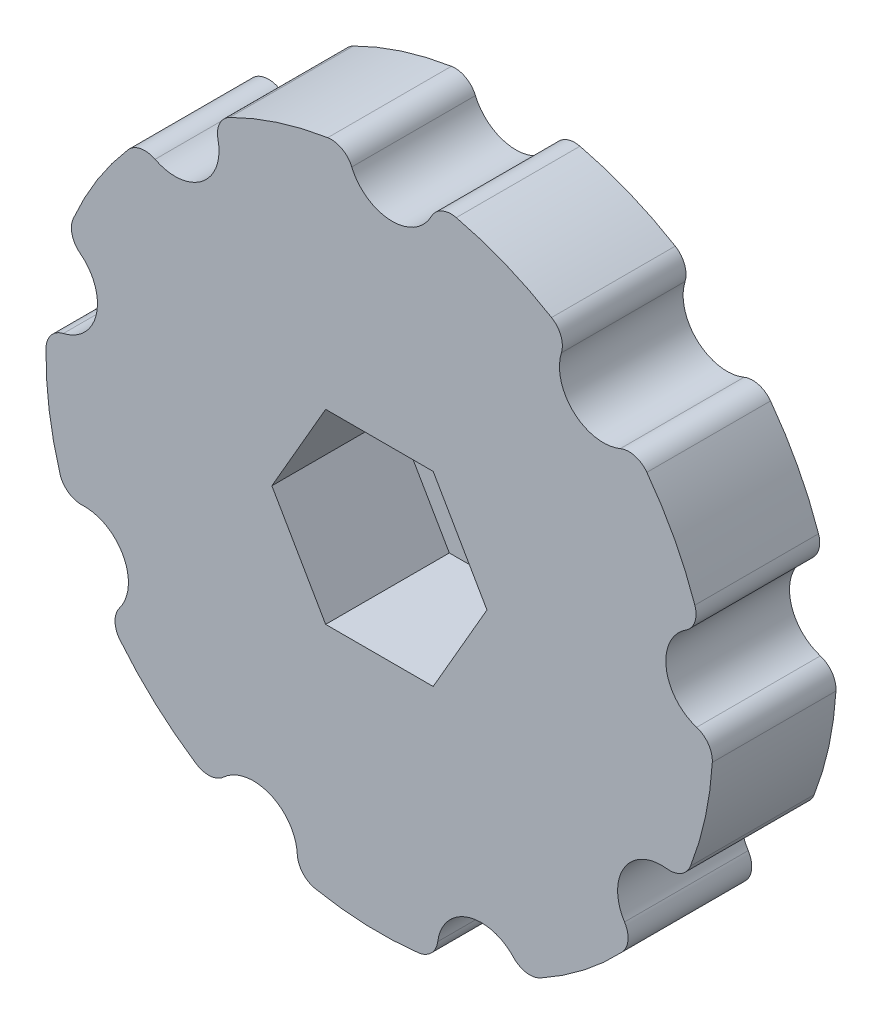
from build123d import *

# Parameters (mm, degrees)
CROQUIS1_R              = 2.2
SALIENTE_EXTRUIR1_DEPTH = 8.3
CORTAR_EXTRUIR1_DEPTH   = 10
CROQUIS3_R              = 11.19
CROQUIS3_R_2            = 2.2
SALIENTE_EXTRUIR2_DEPTH = 3
REDONDEO1_R             = 10
REDONDEO2_R             = 10


with BuildPart() as part:
    # Croquis1 → Saliente-Extruir1 (new body)
    with BuildSketch(Plane.XY):
        with BuildLine():
            ThreePointArc((-1.855132773, 21.210566025), (0.747663665, 19.413438157), (3.480969897, 21.005058374))
            ThreePointArc((3.480969897, 21.005058374), (4.187425829, 21.678765959), (5.158862158, 21.775064198))
            ThreePointArc((5.158862158, 21.775064198), (8.457254598, 20.718159287), (11.553044037, 19.164927682))
            ThreePointArc((11.553044037, 19.164927682), (12.17958806, 18.416325998), (12.212774884, 17.4406926))
            ThreePointArc((12.212774884, 17.4406926), (13.051461105, 14.390967482), (16.16836891, 13.853283925))
            ThreePointArc((16.16836891, 13.853283925), (17.142596439, 13.915272757), (17.948659156, 13.364614252))
            ThreePointArc((17.948659156, 13.364614252), (19.796008974, 10.434812326), (21.16912324, 7.255032793))
            ThreePointArc((21.16912324, 7.255032793), (21.16789192, 6.278835898), (20.566189442, 5.510125275))
            ThreePointArc((20.566189442, 5.510125275), (19.248334843, 2.634803184), (21.290408418, 0.219403966))
            ThreePointArc((21.290408418, 0.219403966), (22.076555656, -0.359331218), (22.340079057, -1.299287234))
            ThreePointArc((22.340079057, -1.299287234), (21.871990743, -4.731099292), (20.879934411, -8.049572571))
            ThreePointArc((20.879934411, -8.049572571), (20.251503896, -8.796591301), (19.296455393, -8.998690904))
            ThreePointArc((19.296455393, -8.998690904), (16.438698786, -10.354214806), (16.450429211, -13.517137548))
            ThreePointArc((16.450429211, -13.517137548), (16.680649129, -14.465800124), (16.278327685, -15.355237783))
            ThreePointArc((16.278327685, -15.355237783), (13.713824964, -17.683276971), (10.820792216, -19.587693468))
            ThreePointArc((10.820792216, -19.587693468), (9.859212129, -19.755995666), (8.997695409, -19.2969196))
            ThreePointArc((8.997695409, -19.2969196), (5.937212872, -18.498380614), (3.91311135, -20.928860176))
            ThreePointArc((3.91311135, -20.928860176), (3.479681489, -21.803560382), (2.599765876, -22.226301918))
            ThreePointArc((2.599765876, -22.226301918), (-0.861191929, -22.361252828), (-4.301518916, -21.960514898))
            ThreePointArc((-4.301518916, -21.960514898), (-5.146314566, -21.471350096), (-5.511186255, -20.565905154))
            ThreePointArc((-5.511186255, -20.565905154), (-7.34236093, -17.986948546), (-10.455194801, -18.54773653))
            ThreePointArc((-10.455194801, -18.54773653), (-11.349467792, -18.939192417), (-12.29525528, -18.697432369))
            ThreePointArc((-12.29525528, -18.697432369), (-15.033247546, -16.576149969), (-17.411101542, -14.057767343))
            ThreePointArc((-17.411101542, -14.057767343), (-17.743823481, -13.140021189), (-17.44132262, -12.211875121))
            ThreePointArc((-17.44132262, -12.211875121), (-17.186362452, -9.059223351), (-19.931399108, -7.487920827))
            ThreePointArc((-19.931399108, -7.487920827), (-20.868074958, -7.212965835), (-21.437189843, -6.419826415))
            ThreePointArc((-21.437189843, -6.419826415), (-22.171079561, -3.034882316), (-22.373836253, 0.422765786))
            ThreePointArc((-22.373836253, 0.422765786), (-22.038800189, 1.339669668), (-21.210470293, 1.856227))
            ThreePointArc((-21.210470293, 1.856227), (-18.988673977, 4.107413132), (-20.08148026, 7.075576251))
            ThreePointArc((-20.08148026, 7.075576251), (-20.622277928, 7.888287624), (-20.548425031, 8.861687667))
            ThreePointArc((-20.548425031, 8.861687667), (-18.934817045, 11.926440502), (-16.867604324, 14.705482106))
            ThreePointArc((-16.867604324, 14.705482106), (-16.021577354, 15.192514199), (-15.055003187, 15.055779879))
            ThreePointArc((-15.055003187, 15.055779879), (-11.905973913, 15.352145362), (-10.835213617, 18.328332564))
            ThreePointArc((-10.835213617, 18.328332564), (-10.727087865, 19.298523636), (-10.044823777, 19.996719603))
            ThreePointArc((-10.044823777, 19.996719603), (-6.838743197, 21.307249261), (-3.468832869, 22.107339915))
            ThreePointArc((-3.468832869, 22.107339915), (-2.507680415, 21.936612489), (-1.855132773, 21.210566025))
        make_face()
        with Locations(Location((0, 0, 0), (0, 0, 180))):
            Circle(CROQUIS1_R, mode=Mode.SUBTRACT)
    extrude(amount=SALIENTE_EXTRUIR1_DEPTH)

    # Croquis2 → Cortar-Extruir1 (cut)
    with BuildSketch(Plane.XY.offset(8.3)):
        Polygon((7.216878365, 0), (3.608439182, 6.25), (-3.608439182, 6.25), (-7.216878365, 0), (-3.608439182, -6.25), (3.608439182, -6.25), align=None)
    extrude(amount=-CORTAR_EXTRUIR1_DEPTH, mode=Mode.SUBTRACT)

    # Croquis3 → Saliente-Extruir2 (add)
    with BuildSketch(Plane(origin=(0, 0, 0), x_dir=(-1, 0, 0), z_dir=(0, 0, -1))):
        with Locations(Location((0, 0, 0), (0, 0, 180))):
            Circle(CROQUIS3_R)
        Circle(CROQUIS3_R_2, mode=Mode.SUBTRACT)
    extrude(amount=SALIENTE_EXTRUIR2_DEPTH)

    # Redondeo1
    # the kernel refuses this fillet: 10 mm, written as the material it adds along each edge
    with BuildSketch(Plane(origin=(0, 0, 0), x_dir=(1, 0, 0), z_dir=(0, 1, 0))) as redondeo1_piece_1:
        with BuildLine():
            CenterArc((18.331428429, 10), REDONDEO1_R, 224.427004001, 45.572995999)
            Line((11.19, 3), (11.047171431, 2.86))
            ThreePointArc((11.047171431, 2.86), (10.99, 1.5), (10.99, 0))
            Line((10.99, 0), (11.19, -0.2))
            Line((11.19, -0.2), (18.331428429, -0.2))
            Line((18.331428429, -0.2), (18.331428429, 0))
        make_face()
    revolve(axis=Axis((0, 0, 0), (0, 0, -1)))

    # Redondeo2
    redondeo2_edges = [part.edges().sort_by_distance(p)[0] for p in [
        (-11.19, 0, -3),
    ]]
    fillet(redondeo2_edges, radius=REDONDEO2_R)


solid = part.part
